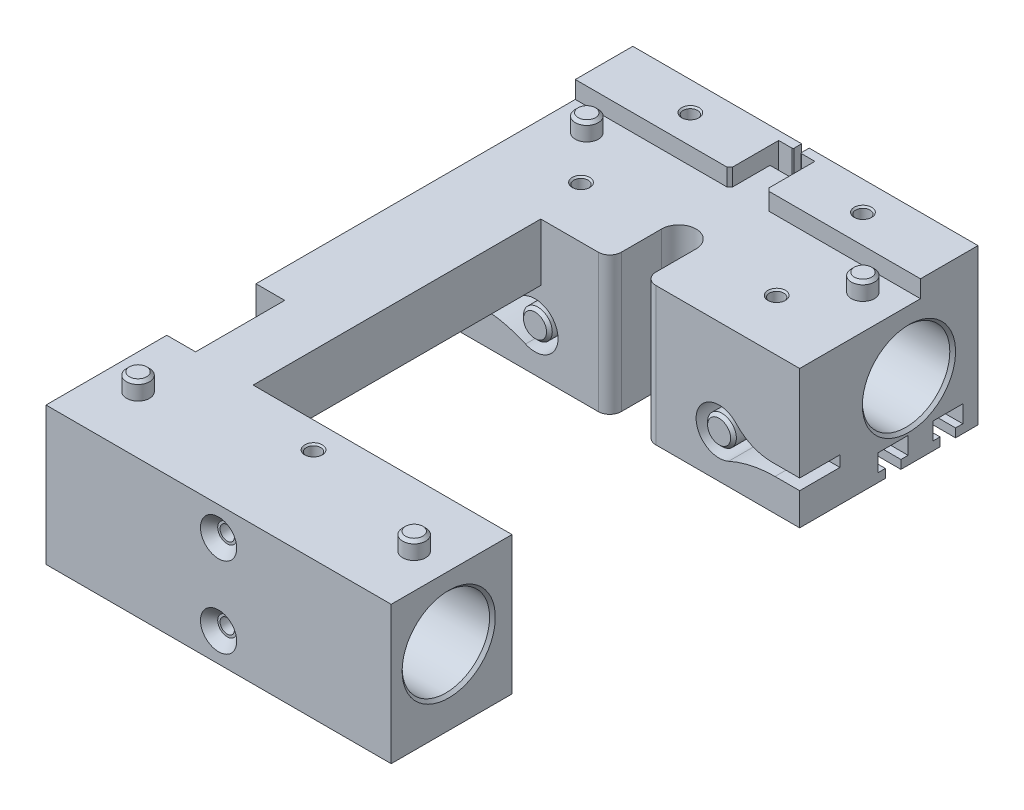
from build123d import *

# Parameters (mm, degrees)
BOSS_EXTRUDE1_DEPTH          = 24
SKETCH2_W                    = 50
SKETCH2_H                    = 14
CUT_EXTRUDE1_DEPTH           = 24
SKETCH3_R                    = 6
CUT_EXTRUDE2_DEPTH           = 121.747670785
SKETCH4_W                    = 60
SKETCH4_H                    = 10
BOSS_EXTRUDE2_DEPTH          = 3
SKETCH5_W                    = 5
SKETCH5_H                    = 15.5
CUT_EXTRUDE3_DEPTH           = 15
SKETCH6_R                    = 2
BOSS_EXTRUDE3_DEPTH          = 3
CHAMFER1_SIZE                = 0.5
M3_TAPPED_HOLE1_D            = 2.5
M3_TAPPED_HOLE1_DEPTH        = 7.5
M3_TAPPED_HOLE1_CSINK_D      = 3.05
M3_TAPPED_HOLE1_CSINK_ANGLE  = 90
M3_TAPPED_HOLE1_TIP          = 0.751075774
M3_TAPPED_HOLE2_D            = 2.5
M3_TAPPED_HOLE2_DEPTH        = 7.5
M3_TAPPED_HOLE2_CSINK_D      = 3.05
M3_TAPPED_HOLE2_CSINK_ANGLE  = 90
M3_TAPPED_HOLE2_TIP          = 0.751075774
CUT_EXTRUDE4_DEPTH           = 25
FILLET1_R                    = 2
SKETCH15_R                   = 7.6
CUT_EXTRUDE5_DEPTH           = 26
CUT_EXTRUDE6_START           = -26
SKETCH16_R                   = 7.6
CUT_EXTRUDE6_DEPTH           = 26
CHAMFER2_SIZE                = 0.5
M3_TAPPED_HOLE6_D            = 2.5
M3_TAPPED_HOLE6_DEPTH        = 7
M3_TAPPED_HOLE6_CSINK_D      = 3.05
M3_TAPPED_HOLE6_CSINK_ANGLE  = 90
M3_TAPPED_HOLE6_TIP          = 0.751075774
M3_TAPPED_HOLE7_D            = 2.5
M3_TAPPED_HOLE7_DEPTH        = 6
M3_TAPPED_HOLE7_CSINK_D      = 3.05
M3_TAPPED_HOLE7_CSINK_ANGLE  = 90
M3_TAPPED_HOLE7_TIP          = 0.751075774
SKETCH18_R                   = 3.15
CUT_EXTRUDE9_DEPTH           = 1.5
CUT_EXTRUDE9_DRAFT           = -45
CUT_EXTRUDE9_PROFILE_2_DEPTH = 1.5
CUT_EXTRUDE9_PROFILE_2_DRAFT = -45
M3_TAPPED_HOLE9_2_OUTLINE_W  = 1.113452075
M3_TAPPED_HOLE9_2_OUTLINE_H  = 4.482071234
CUT_EXTRUDE10_DEPTH          = 110.695031793
SKETCH31_R                   = 4
CUT_EXTRUDE11_DEPTH          = 3
SKETCH32_R                   = 1.5
BOSS_EXTRUDE4_DEPTH          = 3
CHAMFER3_SIZE                = 0.5
FILLET2_R                    = 0.2
CUT_EXTRUDE12_DEPTH          = 122.379569967
CUT_EXTRUDE13_DEPTH          = 7
SKETCH35_R                   = 2.5
BOSS_EXTRUDE5_DEPTH          = 7
CHAMFER4_SIZE                = 0.5
SKETCH36_W                   = 6.3
SKETCH36_H                   = 7
CUT_EXTRUDE14_DEPTH          = 3
CHAMFER5_SIZE                = 0.5
CUT_EXTRUDE15_START          = -4
CUT_EXTRUDE15_DEPTH          = 4


# Read off the part's stored shape, not the designer's step: M3 Tapped Hole8, M3 Tapped Hole9
with BuildPart() as part:
    # Sketch1 → Boss-Extrude1 (new body)
    with BuildSketch(Plane(origin=(0, 0, 0), x_dir=(1, 0, 0), z_dir=(0, 1, 0))):
        Polygon((30, 0), (-30, 0), (-30, 102), (30, 102), (30, 71), (-15, 71), (-15, 21), (30, 21), align=None)
    extrude(amount=BOSS_EXTRUDE1_DEPTH)

    # Sketch2 → Cut-Extrude1 (cut)
    with BuildSketch(Plane(origin=(-15, 0, 0), x_dir=(0, 0, -1), z_dir=(1, 0, 0))):
        with Locations((46, 7)):
            Rectangle(SKETCH2_W, SKETCH2_H)
    extrude(amount=-CUT_EXTRUDE1_DEPTH, mode=Mode.SUBTRACT)

    # Sketch3 → Cut-Extrude2 (cut, through all)
    with BuildSketch(Plane(origin=(30, 0, 0), x_dir=(0, 0, -1), z_dir=(1, 0, 0))):
        with Locations((10, 13)):
            Circle(SKETCH3_R)
        with Locations((90, 13)):
            Circle(SKETCH3_R)
    extrude(amount=-CUT_EXTRUDE2_DEPTH, mode=Mode.SUBTRACT)

    # Sketch4 → Boss-Extrude2 (add)
    with BuildSketch(Plane(origin=(0, 24, 0), x_dir=(1, 0, 0), z_dir=(0, 1, 0))):
        with Locations((0, 97)):
            Rectangle(SKETCH4_W, SKETCH4_H)
    extrude(amount=BOSS_EXTRUDE2_DEPTH)

    # Sketch5 → Cut-Extrude3 (cut)
    with BuildSketch(Plane(origin=(0, 24, 0), x_dir=(1, 0, 0), z_dir=(0, 1, 0))):
        with Locations((-27.5, 28.75)):
            Rectangle(SKETCH5_W, SKETCH5_H)
    extrude(amount=-CUT_EXTRUDE3_DEPTH, mode=Mode.SUBTRACT)

    # Sketch6 → Boss-Extrude3 (add)
    with BuildSketch(Plane(origin=(0, 24, 0), x_dir=(1, 0, 0), z_dir=(0, 1, 0))):
        with Locations(Location((24, 10, 0), (0, 0, 90))):
            Circle(SKETCH6_R)
        with Locations(Location((-24, 10, 0), (0, 0, 90))):
            Circle(SKETCH6_R)
        with Locations(Location((-24, 88, 0), (0, 0, 90))):
            Circle(SKETCH6_R)
        with Locations(Location((24, 88, 0), (0, 0, 90))):
            Circle(SKETCH6_R)
    extrude(amount=BOSS_EXTRUDE3_DEPTH)

    # Chamfer1
    chamfer1_edges = [part.edges().sort_by_distance(p)[0] for p in [
        (24, 27, -8),
        (-24, 27, -8),
        (-24, 27, -86),
        (24, 27, -86),
    ]]
    chamfer(chamfer1_edges, length=CHAMFER1_SIZE)

    # M3 Tapped Hole1
    with Locations(Plane(origin=(0, 24, -16.5), x_dir=(0, 0, 1), z_dir=(0, 1, 0))):
        with Locations((0, 0), (-63.5, 17), (-63.5, -17)):
            CounterSinkHole(M3_TAPPED_HOLE1_D / 2, M3_TAPPED_HOLE1_CSINK_D / 2, depth=M3_TAPPED_HOLE1_DEPTH, counter_sink_angle=M3_TAPPED_HOLE1_CSINK_ANGLE)
            with Locations((0, 0, -(M3_TAPPED_HOLE1_DEPTH + M3_TAPPED_HOLE1_TIP / 2))):  # 118° drill point
                Cone(0, M3_TAPPED_HOLE1_D / 2, M3_TAPPED_HOLE1_TIP, mode=Mode.SUBTRACT)

    # M3 Tapped Hole2
    with Locations(Plane(origin=(-25, 19, -32.25), x_dir=(0, 0, -1), z_dir=(-1, 0, 0))):
        with Locations((0, 0), (-7, 0)):
            CounterSinkHole(M3_TAPPED_HOLE2_D / 2, M3_TAPPED_HOLE2_CSINK_D / 2, depth=M3_TAPPED_HOLE2_DEPTH, counter_sink_angle=M3_TAPPED_HOLE2_CSINK_ANGLE)
            with Locations((0, 0, -(M3_TAPPED_HOLE2_DEPTH + M3_TAPPED_HOLE2_TIP / 2))):  # 118° drill point
                Cone(0, M3_TAPPED_HOLE2_D / 2, M3_TAPPED_HOLE2_TIP, mode=Mode.SUBTRACT)

    # Sketch12 → Cut-Extrude4 (cut)
    with BuildSketch(Plane(origin=(0, 24, 0), x_dir=(1, 0, 0), z_dir=(0, 1, 0))):
        with BuildLine():
            Line((3, 80), (3, 71))
            Line((3, 71), (-3, 71))
            Line((-3, 71), (-3, 80))
            ThreePointArc((-3, 80), (0, 83), (3, 80))
        make_face()
    extrude(amount=-CUT_EXTRUDE4_DEPTH, mode=Mode.SUBTRACT)

    # Fillet1
    fillet1_edges = [part.edges().sort_by_distance(p)[0] for p in [
        (-3, 12, -71),
        (3, 12, -71),
    ]]
    fillet(fillet1_edges, radius=FILLET1_R)

    # Sketch15 → Cut-Extrude5 (cut)
    with BuildSketch(Plane(origin=(30, 0, 0), x_dir=(0, 0, -1), z_dir=(1, 0, 0))):
        with Locations((10, 13)):
            Circle(SKETCH15_R)
        with Locations((90, 13)):
            Circle(SKETCH15_R)
    extrude(amount=-CUT_EXTRUDE5_DEPTH, mode=Mode.SUBTRACT)

    # Sketch16 → Cut-Extrude6 (cut)
    with BuildSketch(Plane.ZY.offset(30).offset(CUT_EXTRUDE6_START)):
        with Locations(Location((-90, 13, 0), (0, 0, 180))):
            Circle(SKETCH16_R)
        with Locations(Location((-10, 13, 0), (0, 0, 180))):
            Circle(SKETCH16_R)
    extrude(amount=CUT_EXTRUDE6_DEPTH, mode=Mode.SUBTRACT)

    # Chamfer2
    chamfer2_edges = [part.edges().sort_by_distance(p)[0] for p in [
        (30, 13, -2.4),
        (30, 13, -82.4),
        (-30, 13, -82.4),
        (-30, 13, -2.4),
    ]]
    chamfer(chamfer2_edges, length=CHAMFER2_SIZE)

    # M3 Tapped Hole6
    with Locations(Plane(origin=(-15, 27, -97), x_dir=(0, 0, 1), z_dir=(0, 1, 0))):
        with Locations((0, 0), (0, 30)):
            CounterSinkHole(M3_TAPPED_HOLE6_D / 2, M3_TAPPED_HOLE6_CSINK_D / 2, depth=M3_TAPPED_HOLE6_DEPTH, counter_sink_angle=M3_TAPPED_HOLE6_CSINK_ANGLE)
            with Locations((0, 0, -(M3_TAPPED_HOLE6_DEPTH + M3_TAPPED_HOLE6_TIP / 2))):  # 118° drill point
                Cone(0, M3_TAPPED_HOLE6_D / 2, M3_TAPPED_HOLE6_TIP, mode=Mode.SUBTRACT)

    # M3 Tapped Hole7
    with Locations(Plane(origin=(0, 19, 0), x_dir=(1, 0, 0), z_dir=(0, 0, 1))):
        with Locations((0, 0), (0, -14)):
            CounterSinkHole(M3_TAPPED_HOLE7_D / 2, M3_TAPPED_HOLE7_CSINK_D / 2, depth=M3_TAPPED_HOLE7_DEPTH, counter_sink_angle=M3_TAPPED_HOLE7_CSINK_ANGLE)
            with Locations((0, 0, -(M3_TAPPED_HOLE7_DEPTH + M3_TAPPED_HOLE7_TIP / 2))):  # 118° drill point
                Cone(0, M3_TAPPED_HOLE7_D / 2, M3_TAPPED_HOLE7_TIP, mode=Mode.SUBTRACT)


with BuildPart() as cut_extrude9_tool:
    # Sketch18 → Cut-Extrude9 (with draft: the straight prism first)
    with BuildSketch(Plane.XY):
        with Locations((0, 19)):
            Circle(SKETCH18_R)
    extrude(amount=-CUT_EXTRUDE9_DEPTH)
    # Cut-Extrude9: the draft: its side faces are tilted about the plane it starts from
    cut_extrude9_sides = [cut_extrude9_tool.faces().sort_by_distance(p)[0] for p in [
        (-3.15, 19, -0.75),
    ]]
    draft(cut_extrude9_sides, Plane.XY, CUT_EXTRUDE9_DRAFT)


with BuildPart() as part_1:
    add(part.part)

    # Cut-Extrude9: cut by cut_extrude9_tool
    add(cut_extrude9_tool.part, mode=Mode.SUBTRACT)


with BuildPart() as cut_extrude9_profile_2_tool:
    # Sketch18 → Cut-Extrude9 profile 2 (with draft: the straight prism first)
    with BuildSketch(Plane.XY):
        with Locations((0, 5)):
            Circle(SKETCH18_R)
    extrude(amount=-CUT_EXTRUDE9_PROFILE_2_DEPTH)
    # Cut-Extrude9 profile 2: the draft: its side faces are tilted about the plane it starts from
    cut_extrude9_profile_2_sides = [cut_extrude9_profile_2_tool.faces().sort_by_distance(p)[0] for p in [
        (-3.15, 5, -0.75),
    ]]
    draft(cut_extrude9_profile_2_sides, Plane.XY, CUT_EXTRUDE9_PROFILE_2_DRAFT)


with BuildPart() as part_2:
    add(part_1.part)

    # Cut-Extrude9 profile 2: cut by cut_extrude9_profile_2_tool
    add(cut_extrude9_profile_2_tool.part, mode=Mode.SUBTRACT)

    # M3 Tapped Hole8 outline → M3 Tapped Hole8 (revolve, cut)
    with BuildSketch(Plane(origin=(16, 0, -10.5), x_dir=(1, 0, 0), z_dir=(0, 0, 1))):
        Polygon((0, 0), (1.525, 0), (1.25, 0.275), (1.25, 5.416465204), (1.020304703, 5.554480063), (0, 5.554480063), align=None)
    revolve(axis=Axis((16, 0, -10.5), (0, 1, 0)), mode=Mode.SUBTRACT)

    # M3 Tapped Hole8 2 outline → M3 Tapped Hole8 2 (revolve, cut)
    with BuildSketch(Plane(origin=(-16, 0, -10.5), x_dir=(1, 0, 0), z_dir=(0, 0, 1))):
        Polygon((0, 0), (1.525, 0), (1.25, 0.275), (1.25, 5.416465204), (1.021260922, 5.553905508), (0, 5.553905508), align=None)
    revolve(axis=Axis((-16, 0, -10.5), (0, 1, 0)), mode=Mode.SUBTRACT)

    # M3 Tapped Hole9 outline → M3 Tapped Hole9 (revolve, cut)
    with BuildSketch(Plane(origin=(16, 13, 0), x_dir=(1, 0, 0), z_dir=(0, -1, 0))):
        Polygon((0, -102), (1.525, -102), (1.25, -101.725), (1.25, -97.6), (1.113452017, -97.517953695), (0, -97.517953695), align=None)
    revolve(axis=Axis((16, 13, 0), (0, 0, 1)), mode=Mode.SUBTRACT)

    # M3 Tapped Hole9 2 outline → M3 Tapped Hole9 2 (revolve, cut)
    with BuildSketch(Plane(origin=(-16, 13, 0), x_dir=(1, 0, 0), z_dir=(0, -1, 0))):
        with Locations((0.556726038, -99.758964383)):
            Rectangle(M3_TAPPED_HOLE9_2_OUTLINE_W, M3_TAPPED_HOLE9_2_OUTLINE_H)
        Polygon((1.25, -97.6), (1.113452075, -97.51795373), (1.113452075, -102), (1.25, -102), (1.25, -101.725), align=None)
        Polygon((1.525, -102), (1.25, -101.725), (1.25, -102), align=None)
    revolve(axis=Axis((-16, 13, 0), (0, 0, 1)), mode=Mode.SUBTRACT)

    # Sketch30 → Cut-Extrude10 (cut, through all)
    with BuildSketch(Plane(origin=(0, 27, 0), x_dir=(1, 0, 0), z_dir=(0, 1, 0))):
        Polygon((0.65, 100.5), (3.15, 100.5), (3.15, 99), (-3.15, 99), (-3.15, 100.5), (-0.65, 100.5), (-0.65, 102), (0.65, 102), align=None)
    extrude(amount=-CUT_EXTRUDE10_DEPTH, mode=Mode.SUBTRACT)

    # Sketch31 → Cut-Extrude11 (cut)
    with BuildSketch(Plane(origin=(0, 0, -102), x_dir=(-1, 0, 0), z_dir=(0, 0, -1))):
        with Locations((0, 13)):
            Circle(SKETCH31_R)
    extrude(amount=-CUT_EXTRUDE11_DEPTH, mode=Mode.SUBTRACT)

    # Sketch32 → Boss-Extrude4 (add)
    with BuildSketch(Plane(origin=(0, 0, -99), x_dir=(-1, 0, 0), z_dir=(0, 0, -1))):
        with Locations(Location((0, 13, 0), (0, 0, 180))):
            Circle(SKETCH32_R)
    extrude(amount=BOSS_EXTRUDE4_DEPTH)

    # Chamfer3
    chamfer3_edges = [part_2.edges().sort_by_distance(p)[0] for p in [
        (-1.5, 13, -102),
    ]]
    chamfer(chamfer3_edges, length=CHAMFER3_SIZE)

    # Fillet2
    fillet2_edges = [part_2.edges().sort_by_distance(p)[0] for p in [
        (-0.65, 4.526582913, -100.5),
        (0.65, 4.526582913, -100.5),
        (-0.65, 21.973417087, -100.5),
        (-2.039305406, 9.558890664, -100.5),
        (-2.039305406, 16.441109336, -100.5),
        (0.65, 21.973417087, -100.5),
        (2.039305406, 9.558890664, -100.5),
        (2.039305406, 16.441109336, -100.5),
    ]]
    fillet(fillet2_edges, radius=FILLET2_R)

    # Sketch33 → Cut-Extrude12 (cut, through all)
    with BuildSketch(Plane(origin=(30, 0, 0), x_dir=(0, 0, -1), z_dir=(1, 0, 0))):
        Polygon((94.15, 4.5), (99.35, 4.5), (99.35, 1.5), (98.1, 1.5), (98.1, 0), (95.4, 0), (95.4, 1.5), (94.15, 1.5), align=None)
        Polygon((84.65, 1.5), (85.9, 1.5), (85.9, 0), (88.6, 0), (88.6, 1.5), (89.85, 1.5), (89.85, 4.5), (84.65, 4.5), align=None)
    extrude(amount=-CUT_EXTRUDE12_DEPTH, mode=Mode.SUBTRACT)

    # Sketch34 → Cut-Extrude13 (cut)
    with BuildSketch(Plane.XY.offset(-71)):
        with BuildLine():
            Line((30, 7.5), (25.186947262, 7.5))
            ThreePointArc((25.186947262, 7.5), (21.77376681, 8.210822798), (18.928110681, 10.225099602))
            ThreePointArc((18.928110681, 10.225099602), (12.078030656, 8.28622927), (17.65147843, 3.856839422))
            ThreePointArc((17.65147843, 3.856839422), (21.592126256, 5.159238759), (25.718950561, 5.6))
            Line((25.718950561, 5.6), (30, 5.6))
            Line((30, 5.6), (30, 7.5))
        make_face()
        with BuildLine():
            Line((-30, 7.5), (-25.186947262, 7.5))
            ThreePointArc((-25.186947262, 7.5), (-21.77376681, 8.210822798), (-18.928110681, 10.225099602))
            ThreePointArc((-18.928110681, 10.225099602), (-12.078030656, 8.28622927), (-17.65147843, 3.856839422))
            ThreePointArc((-17.65147843, 3.856839422), (-21.592126256, 5.159238759), (-25.718950561, 5.6))
            Line((-25.718950561, 5.6), (-30, 5.6))
            Line((-30, 5.6), (-30, 7.5))
        make_face()
    extrude(amount=-CUT_EXTRUDE13_DEPTH, mode=Mode.SUBTRACT)

    # Sketch35 → Boss-Extrude5 (add)
    with BuildSketch(Plane.XY.offset(-78)):
        with Locations((-16, 7.5)):
            Circle(SKETCH35_R)
        with Locations(Location((16, 7.5, 0), (0, 0, 180))):
            Circle(SKETCH35_R)
    extrude(amount=BOSS_EXTRUDE5_DEPTH)

    # Chamfer4
    chamfer4_edges = [part_2.edges().sort_by_distance(p)[0] for p in [
        (-18.5, 7.5, -71),
        (18.5, 7.5, -71),
    ]]
    chamfer(chamfer4_edges, length=CHAMFER4_SIZE)

    # Sketch36 → Cut-Extrude14 (cut)
    with BuildSketch(Plane(origin=(0, 27, 0), x_dir=(1, 0, 0), z_dir=(0, 1, 0))):
        with Locations((0, 95.5)):
            Rectangle(SKETCH36_W, SKETCH36_H)
    extrude(amount=-CUT_EXTRUDE14_DEPTH, mode=Mode.SUBTRACT)

    # Chamfer5
    chamfer5_edges = [part_2.edges().sort_by_distance(p)[0] for p in [
        (-3.15, 25.5, -92),
        (3.15, 25.5, -92),
    ]]
    chamfer(chamfer5_edges, length=CHAMFER5_SIZE)

    # Sketch37 → Cut-Extrude15 (cut)
    with BuildSketch(Plane.XZ.offset(CUT_EXTRUDE15_START)):
        with BuildLine():
            Line((-3, -80), (-3.15, -82.5))
            Line((-3.15, -82.5), (-3.15, -99))
            Line((-3.15, -99), (3.15, -99))
            Line((3.15, -99), (3.15, -82.5))
            Line((3.15, -82.5), (3, -80))
            ThreePointArc((3, -80), (0, -83), (-3, -80))
        make_face()
    extrude(amount=CUT_EXTRUDE15_DEPTH, mode=Mode.SUBTRACT)


solid = part_2.part
